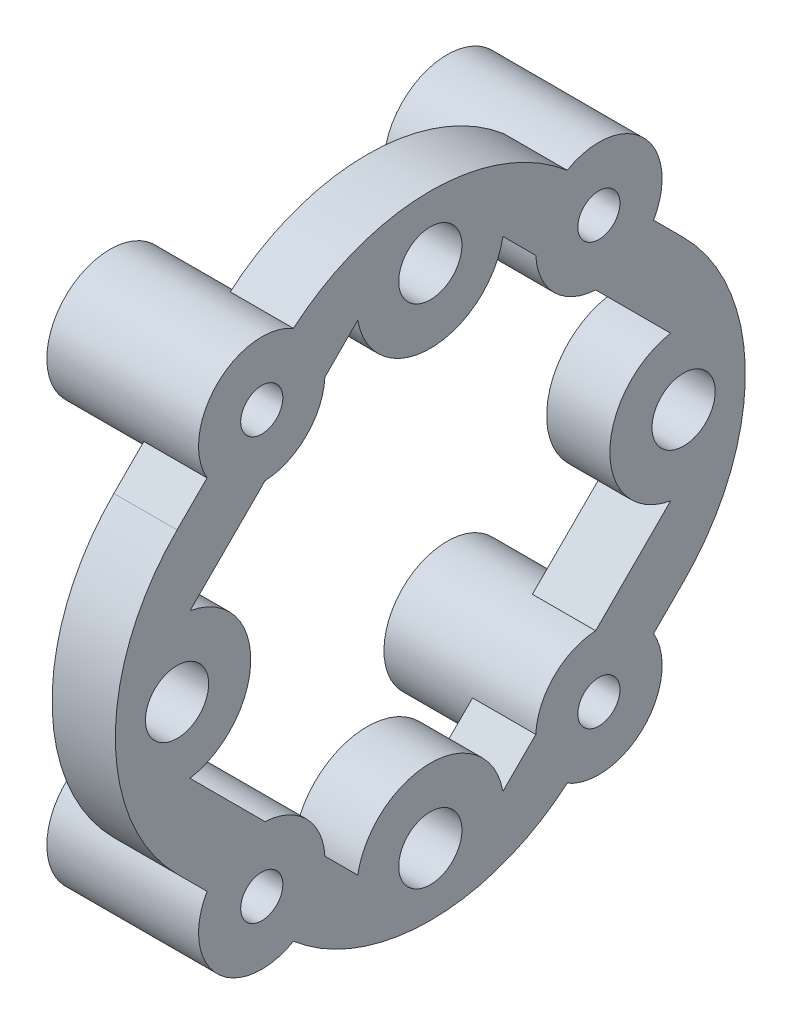
from build123d import *

# Parameters (mm, degrees)
SKETCH1_R             = 3
SKETCH1_R_2           = 1
BOSS_EXTRUDE1_DEPTH   = 7.2
BOSS_EXTRUDE1_2_DEPTH = 7.2
BOSS_EXTRUDE1_3_DEPTH = 7.2
BOSS_EXTRUDE1_4_DEPTH = 7.2
BOSS_EXTRUDE2_START   = -3
SKETCH2_R             = 1.5
BOSS_EXTRUDE2_DEPTH   = 3
FILLET1_R             = 10


with BuildPart() as part:
    # Sketch1 → Boss-Extrude1 (new body)
    with BuildSketch(Plane(origin=(49.162852783, 0, 0), x_dir=(0, 0, -1), z_dir=(1, 0, 0))):
        with Locations(Location((0.658959109, 5.919497669, 0), (0, 0, 270))):
            Circle(SKETCH1_R)
        with Locations(Location((0.658959109, 5.919497669, 0), (0, 0, 270))):
            Circle(SKETCH1_R_2, mode=Mode.SUBTRACT)
    extrude(amount=BOSS_EXTRUDE1_DEPTH)



with BuildPart() as body_2:
    # Sketch1 → Boss-Extrude1 2 (new body)
    with BuildSketch(Plane(origin=(49.162852783, 0, 0), x_dir=(0, 0, -1), z_dir=(1, 0, 0))):
        with Locations(Location((0.658959109, -14.080502331, 0), (0, 0, 270))):
            Circle(SKETCH1_R)
        with Locations(Location((0.658959109, -14.080502331, 0), (0, 0, 270))):
            Circle(SKETCH1_R_2, mode=Mode.SUBTRACT)
    extrude(amount=BOSS_EXTRUDE1_2_DEPTH)


with BuildPart() as body_3:
    # Sketch1 → Boss-Extrude1 3 (new body)
    with BuildSketch(Plane(origin=(49.162852783, 0, 0), x_dir=(0, 0, -1), z_dir=(1, 0, 0))):
        with Locations(Location((16.658959109, -14.080502331, 0), (0, 0, 270))):
            Circle(SKETCH1_R)
        with Locations(Location((16.658959109, -14.080502331, 0), (0, 0, 270))):
            Circle(SKETCH1_R_2, mode=Mode.SUBTRACT)
    extrude(amount=BOSS_EXTRUDE1_3_DEPTH)


with BuildPart() as body_4:
    # Sketch1 → Boss-Extrude1 4 (new body)
    with BuildSketch(Plane(origin=(49.162852783, 0, 0), x_dir=(0, 0, -1), z_dir=(1, 0, 0))):
        with Locations(Location((16.658959109, 5.919497669, 0), (0, 0, 270))):
            Circle(SKETCH1_R)
        with Locations(Location((16.658959109, 5.919497669, 0), (0, 0, 270))):
            Circle(SKETCH1_R_2, mode=Mode.SUBTRACT)
    extrude(amount=BOSS_EXTRUDE1_4_DEPTH)


with BuildPart() as part_1:
    add(part.part)

    add(body_2.part)  # Boss-Extrude2 merges body 2

    add(body_3.part)  # Boss-Extrude2 merges body 3

    add(body_4.part)  # Boss-Extrude2 merges body 4
    # Sketch2 → Boss-Extrude2 (add)
    with BuildSketch(Plane(origin=(56.362852783, 0, 0), x_dir=(0, 0, -1), z_dir=(1, 0, 0)).offset(BOSS_EXTRUDE2_START)):
        with BuildLine():
            Line((-0.336368494, 6.016053158), (-10.432923983, -4.080502331))
            Line((-10.432923983, -4.080502331), (-0.336368494, -14.17705782))
            ThreePointArc((-0.336368494, -14.17705782), (1.366065891, -13.373395549), (0.562403621, -15.075829934))
            Line((0.562403621, -15.075829934), (8.658959109, -23.172385423))
            Line((8.658959109, -23.172385423), (16.755514598, -15.075829934))
            ThreePointArc((16.755514598, -15.075829934), (15.951852328, -13.373395549), (17.654286713, -14.17705782))
            Line((17.654286713, -14.17705782), (27.750842202, -4.080502331))
            Line((27.750842202, -4.080502331), (17.654286713, 6.016053158))
            ThreePointArc((17.654286713, 6.016053158), (15.951852328, 5.212390888), (16.755514598, 6.914825272))
            Line((16.755514598, 6.914825272), (8.658959109, 15.011380761))
            Line((8.658959109, 15.011380761), (0.562403621, 6.914825272))
            ThreePointArc((0.562403621, 6.914825272), (1.366065891, 5.212390888), (-0.336368494, 6.016053158))
        make_face()
        with Locations((-3.361856171, -4.080502331)):
            Circle(SKETCH2_R, mode=Mode.SUBTRACT)
        with BuildLine():
            ThreePointArc((-2.745060132, -7.525725494), (0.138143829, -4.080502331), (-2.745060132, -0.635279167))
            Line((-2.745060132, -0.635279167), (5.213735946, 7.323516911))
            ThreePointArc((5.213735946, 7.323516911), (8.658959109, 4.440312949), (12.104182273, 7.323516911))
            Line((12.104182273, 7.323516911), (20.062978351, -0.635279167))
            ThreePointArc((20.062978351, -0.635279167), (17.17977439, -4.080502331), (20.062978351, -7.525725494))
            Line((20.062978351, -7.525725494), (12.104182273, -15.484521572))
            ThreePointArc((12.104182273, -15.484521572), (8.658959109, -12.601317611), (5.213735946, -15.484521572))
            Line((5.213735946, -15.484521572), (-2.745060132, -7.525725494))
        make_face(mode=Mode.SUBTRACT)
        with Locations((8.658959109, -16.101317611)):
            Circle(SKETCH2_R, mode=Mode.SUBTRACT)
        with Locations((20.67977439, -4.080502331)):
            Circle(SKETCH2_R, mode=Mode.SUBTRACT)
        with Locations((8.658959109, 7.940312949)):
            Circle(SKETCH2_R, mode=Mode.SUBTRACT)
    extrude(amount=BOSS_EXTRUDE2_DEPTH)

    # Fillet1
    # the kernel refuses this fillet: 10 mm, written as the material it takes off along each edge
    with BuildSketch(Plane(origin=(30.395755029, 15.011380761, -8.658959109), x_dir=(0, -0.7071067811865511, -0.7071067811865438), z_dir=(1, 0, 0)), Plane(origin=(30.395755029, -23.172385423, -8.658959109), x_dir=(0, 0.7071067811865509, 0.707106781186544), z_dir=(1, 0, 0))) as fillet1_piece_1:
        with BuildLine():
            CenterArc((9.969337782, -9.969337782), FILLET1_R, 94.487975167, 81.024049665)
            Line((0, -9.186839102), (0, 0))
            Line((0, 0), (9.186839102, 0))
        make_face()
    extrude(amount=48.934195508, mode=Mode.SUBTRACT)
    with BuildSketch(Plane(origin=(28.362852783, -4.080502331, -27.750842202), x_dir=(-4.937700262164531e-15, -0.7071067811865436, 0.7071067811865513), z_dir=(1, 0, 0))) as fillet1_piece_2:
        with BuildLine():
            CenterArc((FILLET1_R, -FILLET1_R), FILLET1_R, 90, 90)
            Line((0, -FILLET1_R), (0, 0))
            Line((0, 0), (FILLET1_R, 0))
        make_face()
    extrude(amount=53, mode=Mode.SUBTRACT)
    with BuildSketch(Plane(origin=(28.362852783, -4.080502331, 10.432923983), x_dir=(0, -0.7071067811865515, -0.7071067811865436), z_dir=(1, 0, 0))) as fillet1_piece_3:
        with BuildLine():
            CenterArc((FILLET1_R, FILLET1_R), FILLET1_R, 180, 90)
            Line((0, FILLET1_R), (0, 0))
            Line((0, 0), (FILLET1_R, 0))
        make_face()
    extrude(amount=53, mode=Mode.SUBTRACT)


solid = part_1.part
